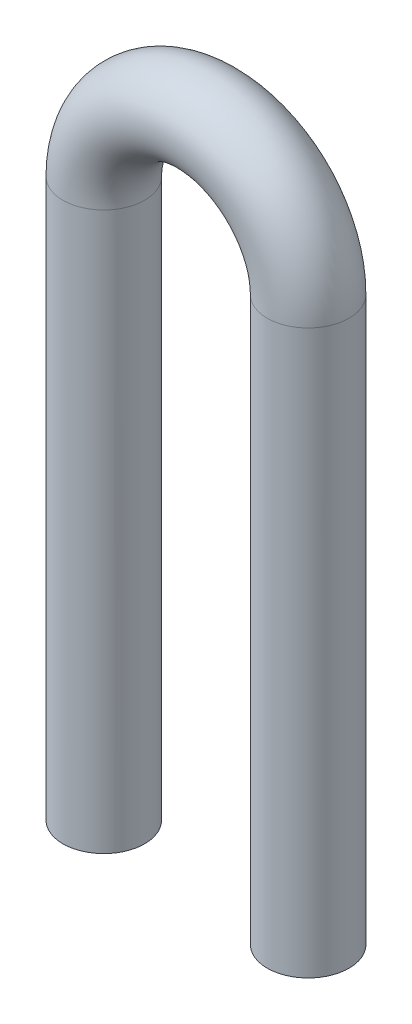
from build123d import *

# Parameters (mm, degrees)
SWEEP1_START        = -27.542372881
SWEEP1_OUTLINE_R    = 4
SWEEP1_DEPTH        = 55.084745762
SWEEP1_2_OUTLINE_R  = 4
SWEEP1_2_DEPTH      = 27.542372881
SWEEP1_3_OUTLINE_R  = 4
SWEEP1_3_ANGLE      = 180
BOSS_EXTRUDE1_START = -27
SKETCH2_2_R         = 4
BOSS_EXTRUDE1_DEPTH = 27


with BuildPart() as part:
    # Sweep1: read off the stored shape, not the designer's step
    # Sweep1 outline → Sweep1 (new body)
    with BuildSketch(Plane(origin=(0, 0, 0), x_dir=(1, 0, 0), z_dir=(0, 1, 0)).offset(SWEEP1_START)):
        with Locations((5, 0)):
            Circle(SWEEP1_OUTLINE_R)
    extrude(amount=SWEEP1_DEPTH)



with BuildPart() as body_2:
    # Sweep1 2 outline → Sweep1 2 (new body)
    with BuildSketch(Plane(origin=(0, 0, 0), x_dir=(1, 0, 0), z_dir=(0, 1, 0))):
        with Locations((-15, 0)):
            Circle(SWEEP1_2_OUTLINE_R)
    extrude(amount=SWEEP1_2_DEPTH)


with BuildPart() as part_1:
    add(part.part)

    add(body_2.part)  # Sweep1 3 merges body 2
    # Sweep1 3 outline → Sweep1 3 (revolve)
    with BuildSketch(Plane(origin=(-5, 27.542372881, 0), x_dir=(1, 0, 0), z_dir=(0, -1, 0))):
        with Locations((10, 0)):
            Circle(SWEEP1_3_OUTLINE_R)
    revolve(axis=Axis((-5, 27.542372881, 0), (0, 0, 1)), revolution_arc=SWEEP1_3_ANGLE)

    # Sketch2<2> → Boss-Extrude1 (add)
    with BuildSketch(Plane(origin=(0, 0, 0), x_dir=(1, 0, 0), z_dir=(0, 1, 0)).offset(BOSS_EXTRUDE1_START)):
        with Locations(Location((-15, 0, 0), (0, 0, 180))):
            Circle(SKETCH2_2_R)
    extrude(amount=BOSS_EXTRUDE1_DEPTH)


solid = part_1.part
